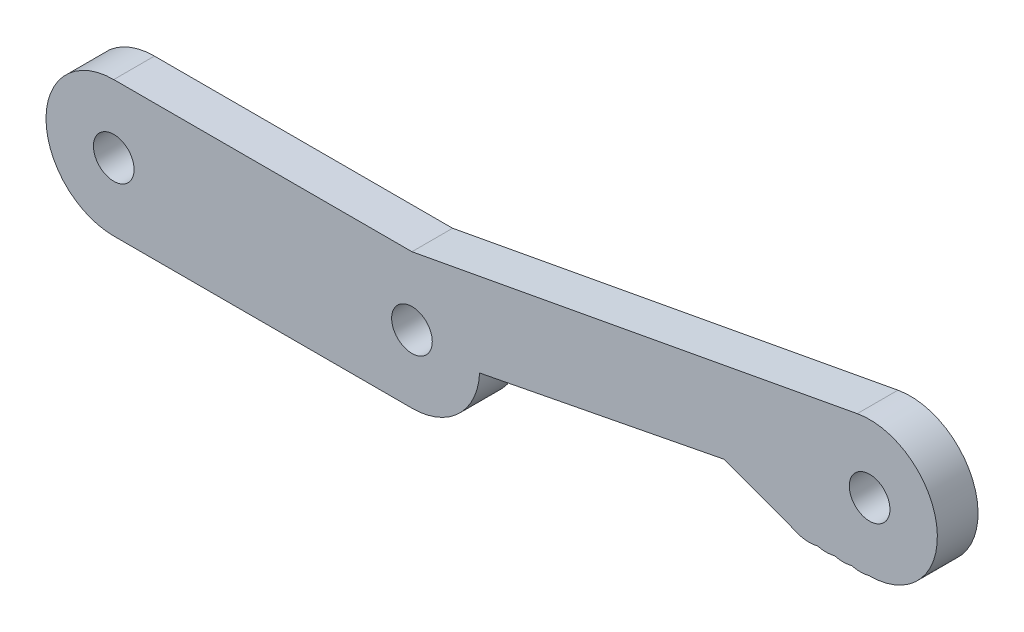
from build123d import *

# Parameters (mm, degrees)
SCHIZZO1_R                   = 1.5
ESTRUSIONE_ESTRUSIONE1_DEPTH = 3


with BuildPart() as part:
    # Schizzo1 → Estrusione-Estrusione1 (new body)
    with BuildSketch(Plane.XY):
        with BuildLine():
            Line((22, 5), (0, 5))
            ThreePointArc((0, 5), (-5, 0), (0, -5))
            Line((0, -5), (22, -5))
            ThreePointArc((22, -5), (25.445859834, -3.622989098), (26.993725045, -0.250420003))
            Line((26.993725045, -0.250420003), (45.041832618, 3.254653548))
            Line((45.041832618, 3.254653548), (50.666477461, 1.165785339))
            ThreePointArc((50.666477461, 1.165785339), (51.293977461, 1.08172232), (51.921477461, 1.165785339))
            ThreePointArc((51.921477461, 1.165785339), (52.551477461, 1.081007878), (53.181477461, 1.165785339))
            ThreePointArc((53.181477461, 1.165785339), (53.811477461, 1.081063133), (54.441477461, 1.165785339))
            ThreePointArc((54.441477461, 1.165785339), (55.071477461, 1.081063133), (55.701477461, 1.165785339))
            Line((55.701477461, 1.165785339), (55.766477461, 1.165785339))
            ThreePointArc((55.766477461, 1.165785339), (60.745551277, 6.622757917), (54.856357382, 11.082255764))
            Line((54.856357382, 11.082255764), (22, 5))
        make_face()
        with Locations((22, 0)):
            Circle(SCHIZZO1_R, mode=Mode.SUBTRACT)
        Circle(SCHIZZO1_R, mode=Mode.SUBTRACT)
        with Locations((55.766477461, 6.165785339)):
            Circle(SCHIZZO1_R, mode=Mode.SUBTRACT)
    extrude(amount=ESTRUSIONE_ESTRUSIONE1_DEPTH)


solid = part.part
